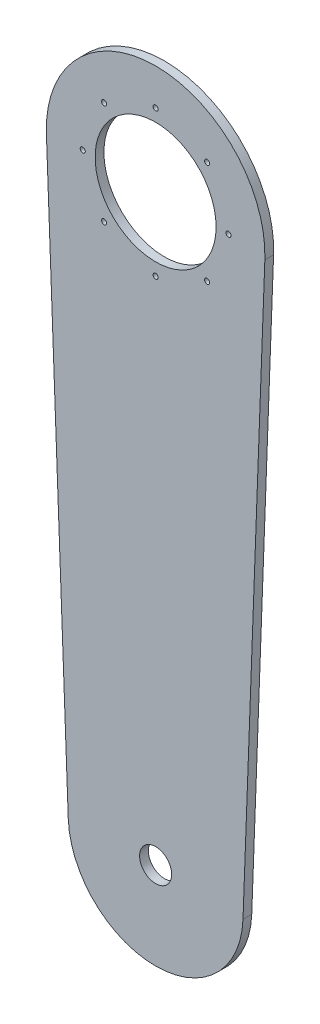
from build123d import *

# Parameters (mm, degrees)
SKETCH_1_R          = 11
SKETCH_1_R_2        = 41.5
EXTRUDE_1_DEPTH     = 6
SKETCH_2_R          = 1.75
CUT_EXTRUDE_1_DEPTH = 10


with BuildPart() as part:
    # 草图1 → 凸台-拉伸1 (new body)
    with BuildSketch(Plane.XY):
        with BuildLine():
            ThreePointArc((74.947247073, -2.8125), (0, 75), (-74.947247073, -2.8125))
            Line((-74.947247073, -2.8125), (-59.957797658, -402.25))
            ThreePointArc((-59.957797658, -402.25), (0, -460), (59.957797658, -402.25))
            Line((59.957797658, -402.25), (74.947247073, -2.8125))
        make_face()
        with Locations((0, -400)):
            Circle(SKETCH_1_R, mode=Mode.SUBTRACT)
        Circle(SKETCH_1_R_2, mode=Mode.SUBTRACT)
    extrude(amount=EXTRUDE_1_DEPTH)

    # 草图2 → 切除-拉伸1 (cut)
    with BuildSketch(Plane.XY.offset(6)):
        with Locations((50, 0)):
            Circle(SKETCH_2_R)
        with Locations((35.355339059, -35.355339059)):
            Circle(SKETCH_2_R)
        with Locations((0, -50)):
            Circle(SKETCH_2_R)
        with Locations((-35.355339059, -35.355339059)):
            Circle(SKETCH_2_R)
        with Locations((-50, 0)):
            Circle(SKETCH_2_R)
        with Locations((-35.355339059, 35.355339059)):
            Circle(SKETCH_2_R)
        with Locations((0, 50)):
            Circle(SKETCH_2_R)
        with Locations((35.355339059, 35.355339059)):
            Circle(SKETCH_2_R)
    extrude(amount=-CUT_EXTRUDE_1_DEPTH, mode=Mode.SUBTRACT)


solid = part.part
